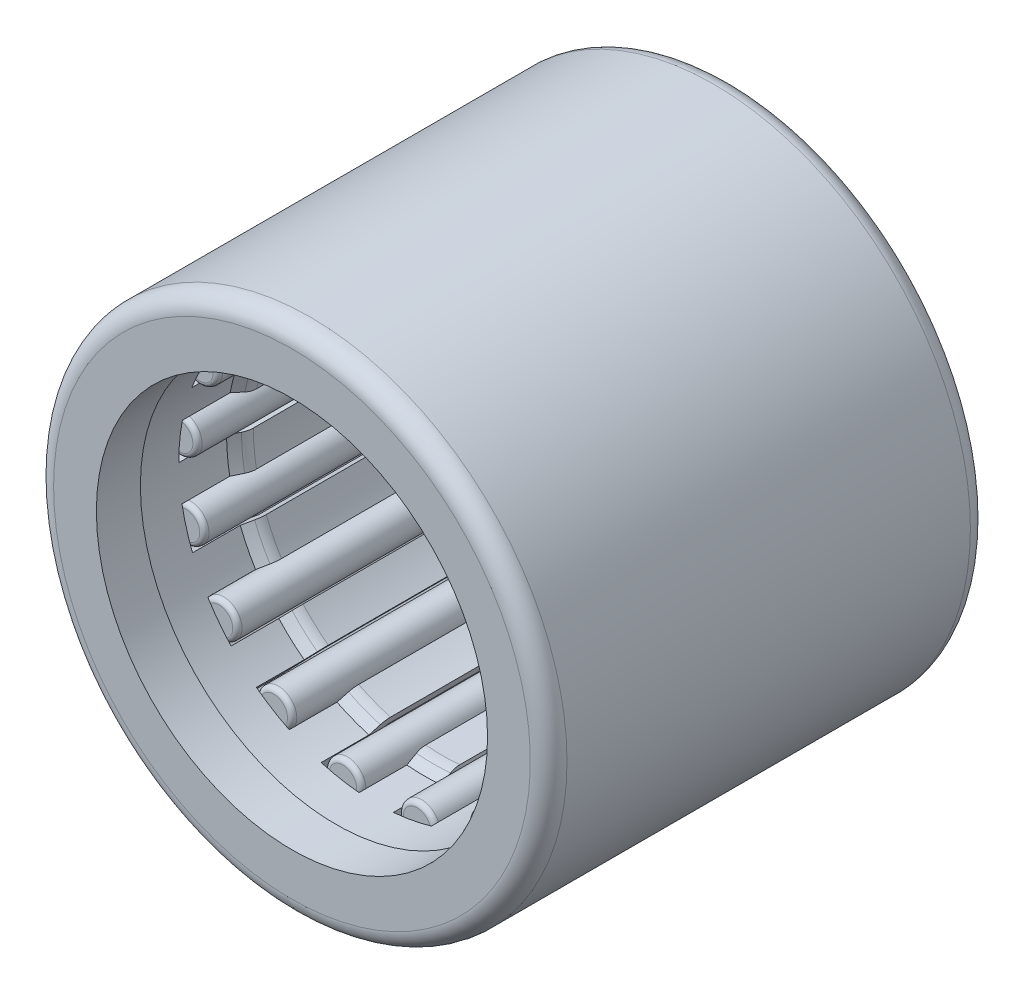
from build123d import *

# Parameters (mm, degrees)
FILLET1_R          = 0.5
SKETCH4_W          = 7.2
SKETCH4_H          = 0.5
FILLET2_R          = 0.127
CIRPATTERN1_COUNT  = 17
FILLET3_R          = 0.508
CUT_EXTRUDE1_DEPTH = 3.7016
CIRPATTERN2_COUNT  = 17


with BuildPart() as part:
    # Sketch3 → Revolve1 (revolve)
    with BuildSketch(Plane(origin=(0, 0, 0), x_dir=(0, 0, -1), z_dir=(1, 0, 0)), mode=Mode.PRIVATE) as revolve1_sk:
        Polygon((4.8, 6.333333333), (4.8, 5.333333333), (6, 5.333333333), (6, 7), (-6, 7), (-6, 5.333333333), (-4.8, 5.333333333), (-4.8, 6.333333333), align=None)
    revolve(revolve1_sk.sketch.rotate(Axis((0, 0, 6), (0, 0, -1)), 90), axis=Axis((0, 0, 6), (0, 0, -1)))

    # Fillet1
    fillet1_edges = [part.edges().sort_by_distance(p)[0] for p in [
        (-7, 0, -6),
        (-7, 0, 6),
    ]]
    fillet(fillet1_edges, radius=FILLET1_R)


with BuildPart() as body_2:
    # Sketch4 → Revolve2 (revolve)
    with BuildSketch(Plane(origin=(0, 0, 0), x_dir=(0, 0, -1), z_dir=(1, 0, 0)), mode=Mode.PRIVATE) as revolve2_sk:
        with Locations((0, 5.25)):
            Rectangle(SKETCH4_W, SKETCH4_H)
    revolve(revolve2_sk.sketch.rotate(Axis((0, 5.5, 3.6), (0, 0, -1)), 270), axis=Axis((0, 5.5, 3.6), (0, 0, -1)))

    # Fillet2
    fillet2_edges = [body_2.edges().sort_by_distance(p)[0] for p in [
        (-0.5, 5.5, 3.6),
        (-0.5, 5.5, -3.6),
    ]]
    fillet(fillet2_edges, radius=FILLET2_R)


with BuildPart() as cirpattern1_1:
    # CirPattern1: pattern copy
    add(body_2.part.rotate(Axis((0, 0, 0), (0, 0, 1)), 1 * 360 / CIRPATTERN1_COUNT))


with BuildPart() as cirpattern1_2:
    # CirPattern1: pattern copy
    add(body_2.part.rotate(Axis((0, 0, 0), (0, 0, 1)), 2 * 360 / CIRPATTERN1_COUNT))


with BuildPart() as cirpattern1_3:
    # CirPattern1: pattern copy
    add(body_2.part.rotate(Axis((0, 0, 0), (0, 0, 1)), 3 * 360 / CIRPATTERN1_COUNT))


with BuildPart() as cirpattern1_4:
    # CirPattern1: pattern copy
    add(body_2.part.rotate(Axis((0, 0, 0), (0, 0, 1)), 4 * 360 / CIRPATTERN1_COUNT))


with BuildPart() as cirpattern1_5:
    # CirPattern1: pattern copy
    add(body_2.part.rotate(Axis((0, 0, 0), (0, 0, 1)), 5 * 360 / CIRPATTERN1_COUNT))


with BuildPart() as cirpattern1_6:
    # CirPattern1: pattern copy
    add(body_2.part.rotate(Axis((0, 0, 0), (0, 0, 1)), 6 * 360 / CIRPATTERN1_COUNT))


with BuildPart() as cirpattern1_7:
    # CirPattern1: pattern copy
    add(body_2.part.rotate(Axis((0, 0, 0), (0, 0, 1)), 7 * 360 / CIRPATTERN1_COUNT))


with BuildPart() as cirpattern1_8:
    # CirPattern1: pattern copy
    add(body_2.part.rotate(Axis((0, 0, 0), (0, 0, 1)), 8 * 360 / CIRPATTERN1_COUNT))


with BuildPart() as cirpattern1_9:
    # CirPattern1: pattern copy
    add(body_2.part.rotate(Axis((0, 0, 0), (0, 0, 1)), 9 * 360 / CIRPATTERN1_COUNT))


with BuildPart() as cirpattern1_10:
    # CirPattern1: pattern copy
    add(body_2.part.rotate(Axis((0, 0, 0), (0, 0, 1)), 10 * 360 / CIRPATTERN1_COUNT))


with BuildPart() as cirpattern1_11:
    # CirPattern1: pattern copy
    add(body_2.part.rotate(Axis((0, 0, 0), (0, 0, 1)), 11 * 360 / CIRPATTERN1_COUNT))


with BuildPart() as cirpattern1_12:
    # CirPattern1: pattern copy
    add(body_2.part.rotate(Axis((0, 0, 0), (0, 0, 1)), 12 * 360 / CIRPATTERN1_COUNT))


with BuildPart() as cirpattern1_13:
    # CirPattern1: pattern copy
    add(body_2.part.rotate(Axis((0, 0, 0), (0, 0, 1)), 13 * 360 / CIRPATTERN1_COUNT))


with BuildPart() as cirpattern1_14:
    # CirPattern1: pattern copy
    add(body_2.part.rotate(Axis((0, 0, 0), (0, 0, 1)), 14 * 360 / CIRPATTERN1_COUNT))


with BuildPart() as cirpattern1_15:
    # CirPattern1: pattern copy
    add(body_2.part.rotate(Axis((0, 0, 0), (0, 0, 1)), 15 * 360 / CIRPATTERN1_COUNT))


with BuildPart() as cirpattern1_16:
    # CirPattern1: pattern copy
    add(body_2.part.rotate(Axis((0, 0, 0), (0, 0, 1)), 16 * 360 / CIRPATTERN1_COUNT))


with BuildPart() as body_19:
    # Sketch6 → Revolve3 (revolve)
    with BuildSketch(Plane(origin=(0, 0, 0), x_dir=(0, 0, -1), z_dir=(1, 0, 0)), mode=Mode.PRIVATE) as revolve3_sk:
        Polygon((-4.8, 5.384133333), (-4.8, 5.833333333), (-2.675819469, 5.833333333), (-1.897782246, 5.384133333), (1.897782246, 5.384133333), (2.675819469, 5.833333333), (4.8, 5.833333333), (4.8, 5.384133333), (2.4, 5.384133333), (2.023336684, 5.166666667), (-2.023336684, 5.166666667), (-2.4, 5.384133333), align=None)
    revolve(revolve3_sk.sketch.rotate(Axis((0, 0, 6), (0, 0, -1)), 90), axis=Axis((0, 0, 6), (0, 0, -1)))

    # Fillet3
    fillet3_edges = [body_19.edges().sort_by_distance(p)[0] for p in [
        (-5.166666667, 0, -2.023336684),
        (-5.166666667, 0, 2.023336684),
    ]]
    fillet(fillet3_edges, radius=FILLET3_R)

    # Sketch7 → Cut-Extrude1 (cut, symmetric)
    with BuildSketch(Plane.XY):
        Polygon((-0.453679099, 4.9492), (0.453679099, 4.9492), (0.647920901, 6.0508), (-0.647920901, 6.0508), align=None)
    cut_extrude1 = extrude(amount=CUT_EXTRUDE1_DEPTH, both=True, mode=Mode.SUBTRACT)

    # CirPattern2: Cut-Extrude1 ×17 about axis
    cirpattern2_axis = Axis((0, 0, 0), (0, 0, 1))
    for i in range(1, CIRPATTERN2_COUNT):
        add(cut_extrude1.rotate(cirpattern2_axis, i * 360 / CIRPATTERN2_COUNT), mode=Mode.SUBTRACT)


solid = Compound([part.part, body_2.part, cirpattern1_1.part, cirpattern1_2.part, cirpattern1_3.part, cirpattern1_4.part, cirpattern1_5.part, cirpattern1_6.part, cirpattern1_7.part, cirpattern1_8.part, cirpattern1_9.part, cirpattern1_10.part, cirpattern1_11.part, cirpattern1_12.part, cirpattern1_13.part, cirpattern1_14.part, cirpattern1_15.part, cirpattern1_16.part, body_19.part])
